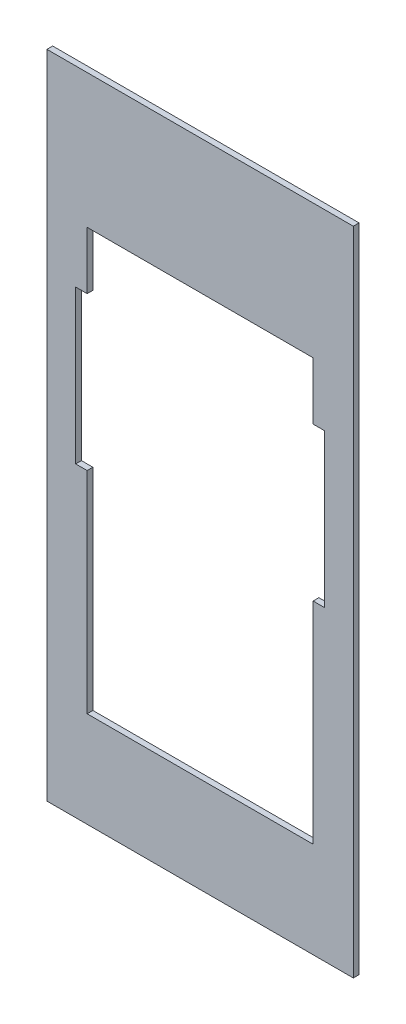
from build123d import *

# Parameters (mm, degrees)
SKETCH1_W           = 80
SKETCH1_H           = 170
BOSS_EXTRUDE1_DEPTH = 1.5


with BuildPart() as part:
    # Sketch1 → Boss-Extrude1 (new body)
    with BuildSketch(Plane.XY):
        Rectangle(SKETCH1_W, SKETCH1_H)
        Polygon((-29.5, -5), (-29.5, -60), (29.5, -60), (29.5, -5), (32.5, -5), (32.5, 35), (29.5, 35), (29.5, 50), (-29.5, 50), (-29.5, 35), (-32.5, 35), (-32.5, -5), align=None, mode=Mode.SUBTRACT)
    extrude(amount=BOSS_EXTRUDE1_DEPTH)


solid = part.part
